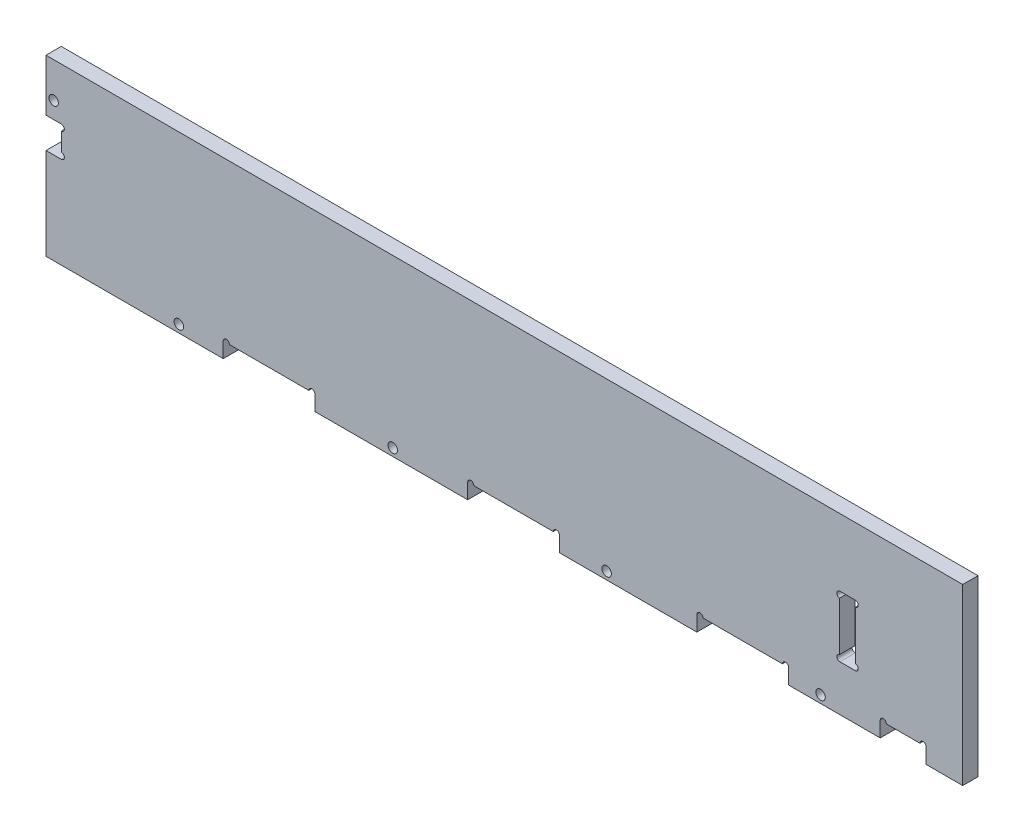
from build123d import *

# Parameters (mm, degrees)
SKETCH_1_W          = 300
SKETCH_1_H          = 57
EXTRUDE_1_DEPTH     = 5
SKETCH_2_W          = 5
SKETCH_2_H          = 10
SKETCH_2_W_2        = 30
SKETCH_2_H_2        = 5
SKETCH_2_W_3        = 15
SKETCH_2_H_3        = 20
CUT_EXTRUDE_1_DEPTH = 5
SKETCH_3_R          = 1
CUT_EXTRUDE_2_DEPTH = 5
SKETCH_4_R          = 1.55
CUT_EXTRUDE_3_DEPTH = 10
SKETCH_7_W          = 5.2
SKETCH_7_H          = 17.800678523
CUT_EXTRUDE_5_DEPTH = 10


with BuildPart() as part:
    # 스케치1 → 보스-돌출1 (new body)
    with BuildSketch(Plane.XY):
        with Locations((150, 28.5)):
            Rectangle(SKETCH_1_W, SKETCH_1_H)
    extrude(amount=EXTRUDE_1_DEPTH)

    # 스케치2 → 컷-돌출1 (cut)
    with BuildSketch(Plane.XY.offset(5)):
        with Locations((2.5, 35)):
            Rectangle(SKETCH_2_W, SKETCH_2_H)
        with Locations((73, 2.5)):
            Rectangle(SKETCH_2_W_2, SKETCH_2_H_2)
        with Locations((153, 2.5)):
            Rectangle(SKETCH_2_W_2, SKETCH_2_H_2)
        with Locations((228, 2.5)):
            Rectangle(SKETCH_2_W_2, SKETCH_2_H_2)
        with Locations((280.5, 2.5)):
            Rectangle(SKETCH_2_W_3, SKETCH_2_H_2)
        with Locations((262.3, 25)):
            Rectangle(SKETCH_2_W, SKETCH_2_H_3)
    extrude(amount=-CUT_EXTRUDE_1_DEPTH, mode=Mode.SUBTRACT)

    # 스케치3 → 컷-돌출2 (cut)
    with BuildSketch(Plane.XY.offset(5)):
        with Locations((274, 5)):
            Circle(SKETCH_3_R)
        with Locations((287, 5)):
            Circle(SKETCH_3_R)
        with Locations((259.8, 16)):
            Circle(SKETCH_3_R)
        with Locations((264.8, 16)):
            Circle(SKETCH_3_R)
        with Locations((264.8, 34)):
            Circle(SKETCH_3_R)
        with Locations((259.8, 34)):
            Circle(SKETCH_3_R)
        with Locations((214, 5)):
            Circle(SKETCH_3_R)
        with Locations((242, 5)):
            Circle(SKETCH_3_R)
        with Locations((87, 5)):
            Circle(SKETCH_3_R)
        with Locations((139, 5)):
            Circle(SKETCH_3_R)
        with Locations((167, 5)):
            Circle(SKETCH_3_R)
        with Locations((5, 31)):
            Circle(SKETCH_3_R)
        with Locations((5, 39)):
            Circle(SKETCH_3_R)
        with Locations((59, 5)):
            Circle(SKETCH_3_R)
    extrude(amount=-CUT_EXTRUDE_2_DEPTH, mode=Mode.SUBTRACT)

    # 스케치4 → 컷-돌출3 (cut)
    with BuildSketch(Plane(origin=(0, 0, 0), x_dir=(-1, 0, 0), z_dir=(0, 0, -1))):
        with Locations((-253.478741621, 2.5)):
            Circle(SKETCH_4_R)
        with Locations((-183.478741621, 2.5)):
            Circle(SKETCH_4_R)
        with Locations((-113.478741621, 2.5)):
            Circle(SKETCH_4_R)
        with Locations((-43.478741621, 2.5)):
            Circle(SKETCH_4_R)
        with Locations((-2.5, 45.45)):
            Circle(SKETCH_4_R)
    extrude(amount=-CUT_EXTRUDE_3_DEPTH, mode=Mode.SUBTRACT)

    # 스케치7 → 컷-돌출5 (cut)
    with BuildSketch(Plane.XY.offset(5)):
        with Locations((262.3, 25.010941884)):
            Rectangle(SKETCH_7_W, SKETCH_7_H)
    extrude(amount=-CUT_EXTRUDE_5_DEPTH, mode=Mode.SUBTRACT)


solid = part.part
